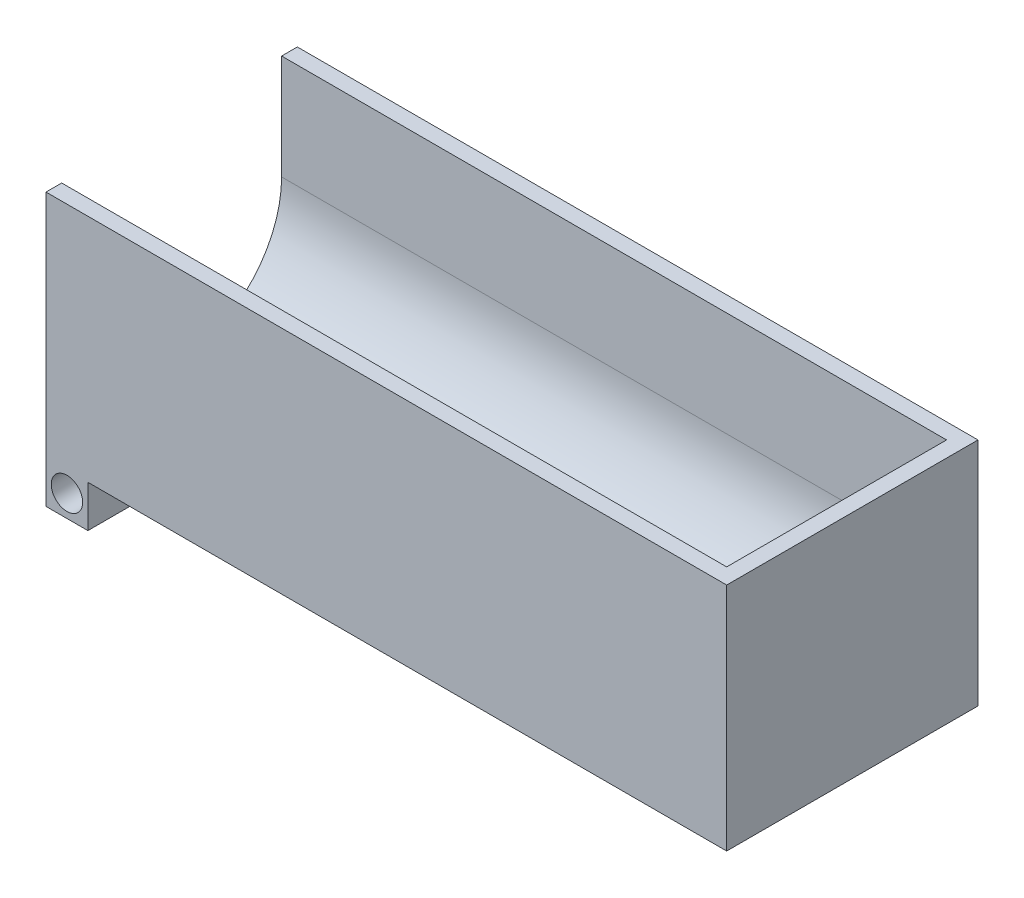
from build123d import *

# Parameters (mm, degrees)
BOSS_EXTRUDE1_DEPTH = 130
SKETCH2_W           = 8
SKETCH2_H           = 8
BOSS_EXTRUDE2_DEPTH = 48
CUT_EXTRUDE1_REACH  = 144.225
SKETCH3_R           = 3
SKETCH4_W           = 48
SKETCH4_H           = 24
BOSS_EXTRUDE3_DEPTH = 3
SKETCH5_W           = 6
SKETCH5_H           = 3
BOSS_EXTRUDE4_DEPTH = 5
SKETCH6_R           = 0.75
CUT_EXTRUDE2_DEPTH  = 139.204522357
BOSS_EXTRUDE5_DEPTH = 20


with BuildPart() as part:
    # Sketch1 → Boss-Extrude1 (new body)
    with BuildSketch(Plane(origin=(0, 0, 0), x_dir=(0, 0, -1), z_dir=(1, 0, 0))):
        with BuildLine():
            Line((21, 0), (24, 0))
            Line((24, 0), (24, -24))
            Line((24, -24), (-24, -24))
            Line((-24, -24), (-24, 0))
            Line((-24, 0), (-21, 0))
            ThreePointArc((-21, 0), (0, -21), (21, 0))
        make_face()
    extrude(amount=BOSS_EXTRUDE1_DEPTH)

    # Sketch2 → Boss-Extrude2 (add)
    with BuildSketch(Plane.XY.offset(24)):
        with Locations((4, -28)):
            Rectangle(SKETCH2_W, SKETCH2_H)
    extrude(amount=-BOSS_EXTRUDE2_DEPTH)

    # Sketch3 → Cut-Extrude1 (cut, up to next)
    with BuildSketch(Plane.XY.offset(24), mode=Mode.PRIVATE) as cut_extrude1_sk1:
        with Locations((4, -27.835840809)):
            Circle(SKETCH3_R)
    cut_extrude1_tool1 = extrude(cut_extrude1_sk1.sketch, amount=-CUT_EXTRUDE1_REACH, mode=Mode.PRIVATE) & part.part
    add(cut_extrude1_tool1.solids().sort_by_distance((4, -27.835841, 24))[0], mode=Mode.SUBTRACT)

    # Sketch4 → Boss-Extrude3 (add)
    with BuildSketch(Plane(origin=(130, 0, 0), x_dir=(0, 0, -1), z_dir=(1, 0, 0))):
        with Locations((0, -12)):
            Rectangle(SKETCH4_W, SKETCH4_H)
    extrude(amount=-BOSS_EXTRUDE3_DEPTH)

    # Sketch5 → Boss-Extrude4 (add)
    with BuildSketch(Plane.XZ.offset(24)):
        with Locations((31, -11.8)):
            Rectangle(SKETCH5_W, SKETCH5_H)
    extrude(amount=BOSS_EXTRUDE4_DEPTH)

    # Sketch6 → Cut-Extrude2 (cut, through all)
    with BuildSketch(Plane.XY.offset(-10.3)):
        with Locations((31, -26.5)):
            Circle(SKETCH6_R)
    extrude(amount=-CUT_EXTRUDE2_DEPTH, mode=Mode.SUBTRACT)

    # Sketch7 → Boss-Extrude5 (add)
    with BuildSketch(Plane(origin=(0, 0, 0), x_dir=(1, 0, 0), z_dir=(0, 1, 0))):
        Polygon((130, 24), (0, 24), (0, 21), (127, 21), (127, -21), (0, -21), (0, -24), (130, -24), align=None)
    extrude(amount=BOSS_EXTRUDE5_DEPTH)


solid = part.part
